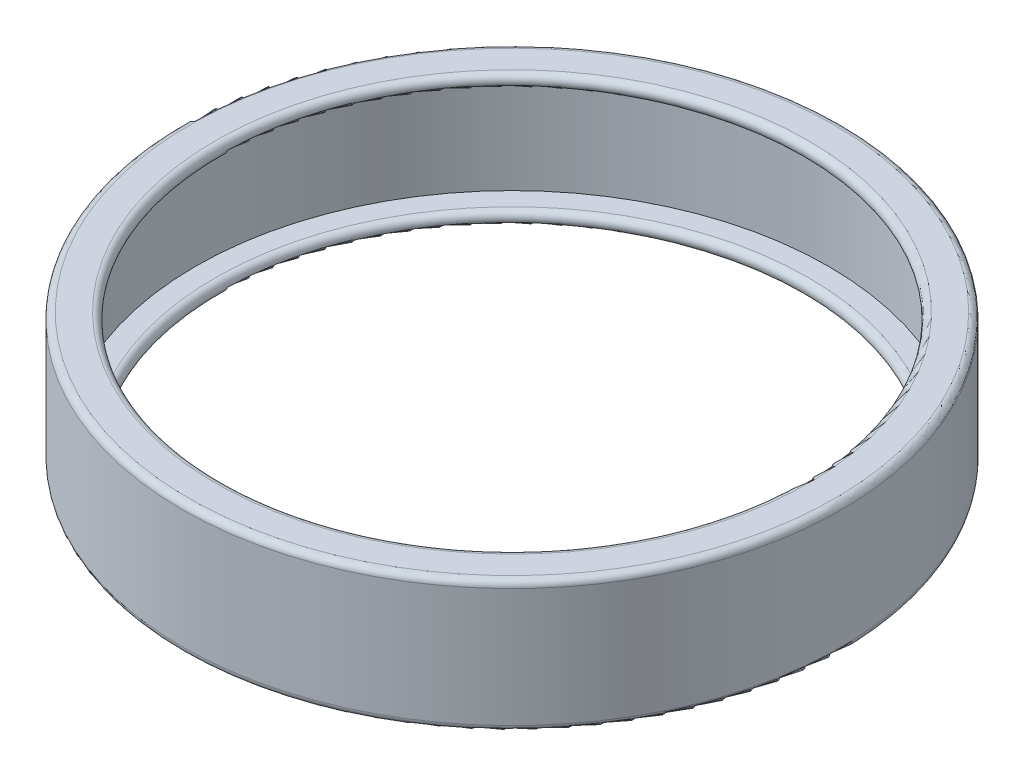
from build123d import *

# Parameters (mm, degrees)
FILLET1_R = 0.5
FILLET2_R = 0.5
FILLET3_R = 0.5


with BuildPart() as part:
    # Sketch1 → Revolve1 (revolve)
    with BuildSketch(Plane.YZ, mode=Mode.PRIVATE) as revolve1_sk:
        Polygon((-5, 22), (-5, 25), (5, 25), (5, 22), (4, 22), (4, 24), (-4, 24), (-4, 22), align=None)
    revolve(revolve1_sk.sketch.rotate(Axis((0, -15.446930484, 0), (0, 1, 0)), 180), axis=Axis((0, -15.446930484, 0), (0, 1, 0)))

    # Fillet1
    fillet1_edges = [part.edges().sort_by_distance(p)[0] for p in [
        (0, 5, 25),
        (0, -5, 25),
    ]]
    fillet(fillet1_edges, radius=FILLET1_R)

    # Fillet2
    fillet2_edges = [part.edges().sort_by_distance(p)[0] for p in [
        (0, 4, 22),
        (0, 5, 22),
    ]]
    fillet(fillet2_edges, radius=FILLET2_R - 0.0001)  # a hair under: the kernel refuses the full size

    # Fillet3
    fillet3_edges = [part.edges().sort_by_distance(p)[0] for p in [
        (0, -5, 22),
        (0, -4, 22),
    ]]
    fillet(fillet3_edges, radius=FILLET3_R - 0.0001)  # a hair under: the kernel refuses the full size


solid = part.part
